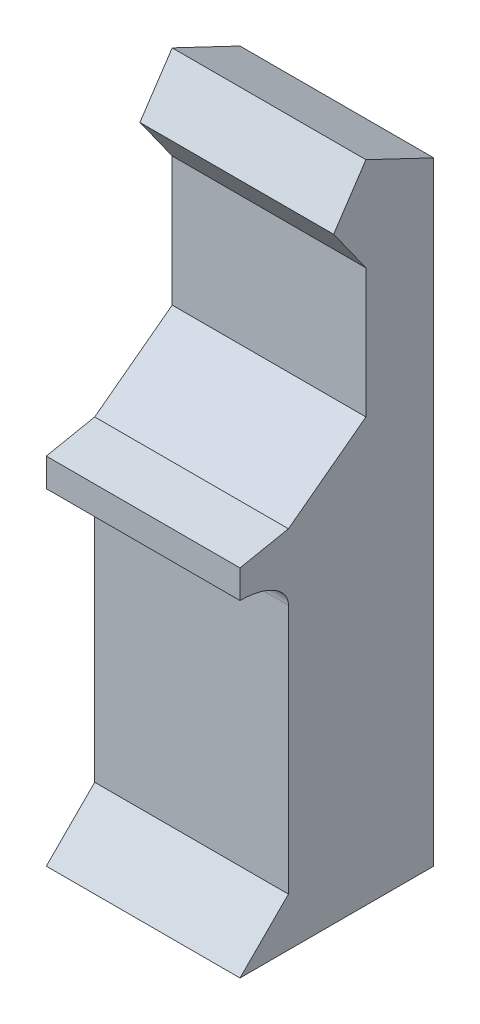
from build123d import *

# Parameters (mm, degrees)
ESQUISSE1_W                   = 600
ESQUISSE1_H                   = 600
BOSS_EXTRU_1_DEPTH            = 2000
ESQUISSE11_W                  = 150
ESQUISSE11_H                  = 800
ENL_V_MAT_EXTRU_1_DEPTH       = 600
ESQUISSE12_W                  = 150
ESQUISSE12_H                  = 1100
ENL_V_MAT_EXTRU_2_DEPTH       = 600
ESQUISSE14_W                  = 150
ESQUISSE14_H                  = 150
BOSS_EXTRU_3_DEPTH            = 600
ENL_V_MAT_EXTRU_5_DEPTH       = 600
ESQUISSE19_W                  = 150
ESQUISSE19_H                  = 100
ENL_V_MAT_EXTRU_6_DEPTH       = 600
ESQUISSE25_W                  = 150
ESQUISSE25_H                  = 100
BOSS_EXTRU_4_DEPTH            = 600
ESQUISSE26_W                  = 150
ESQUISSE26_H                  = 75
BOSS_EXTRU_7_DEPTH            = 600
ESQUISSE30_RX                 = 150
ESQUISSE30_RY                 = 87.5
ENL_V_MAT_EXTRU_7_DEPTH       = 600
ESQUISSE32_W                  = 150
ESQUISSE32_H                  = 30
BOSS_EXTRU_8_DEPTH            = 600
ENL_V_MAT_EXTRU_8_DEPTH       = 2158.978826807
ENL_V_MAT_EXTRU_8_DEPTH_BACK  = 600
ESQUISSE34_W                  = 240
ESQUISSE34_H                  = 870
ENL_V_MAT_EXTRU_9_DEPTH       = 600
ESQUISSE35_W                  = 240
ESQUISSE35_H                  = 180
BOSS_EXTRU_9_DEPTH            = 600
ENL_V_START                   = -600
ENL_V_MAT_EXTRU_10_DEPTH      = 600
ENL_V_MAT_EXTRU_11_DEPTH      = 2158.978826807
ENL_V_MAT_EXTRU_11_DEPTH_BACK = 600
ENL_V_MAT_EXTRU_12_DEPTH      = 2158.978826807
ENL_V_MAT_EXTRU_12_DEPTH_BACK = 600
ESQUISSE41_W                  = 210
ESQUISSE41_H                  = 100
BOSS_EXTRU_10_DEPTH           = 600
ESQUISSE43_W                  = 100
ESQUISSE43_H                  = 150
BOSS_EXTRU_12_DEPTH           = 600
ESQUISSE44_W                  = 100
ESQUISSE44_H                  = 140
BOSS_EXTRU_13_DEPTH           = 600
ENL_V_MAT_EXTRU_13_DEPTH      = 600
ENL_V_MAT_EXTRU_14_DEPTH      = 600
ENL_V_MAT_EXTRU_15_DEPTH      = 600


# Read off the part's stored shape, not the designer's step: Enlèv. mat.-Extru.10
with BuildPart() as part:
    # Esquisse1 → Boss.-Extru.1 (new body)
    with BuildSketch(Plane(origin=(0, 0, 0), x_dir=(1, 0, 0), z_dir=(0, 1, 0))):
        with Locations((224.80933771, 244.860180987)):
            Rectangle(ESQUISSE1_W, ESQUISSE1_H)
    extrude(amount=BOSS_EXTRU_1_DEPTH)

    # Esquisse11 → Enlèv. mat.-Extru.1 (cut)
    with BuildSketch(Plane(origin=(524.80933771, 0, 0), x_dir=(0, 0, -1), z_dir=(1, 0, 0))):
        with Locations((19.860180987, 400)):
            Rectangle(ESQUISSE11_W, ESQUISSE11_H)
    extrude(amount=-ENL_V_MAT_EXTRU_1_DEPTH, mode=Mode.SUBTRACT)

    # Esquisse12 → Enlèv. mat.-Extru.2 (cut)
    with BuildSketch(Plane(origin=(524.80933771, 0, 0), x_dir=(0, 0, -1), z_dir=(1, 0, 0))):
        with Locations((19.860180987, 1450)):
            Rectangle(ESQUISSE12_W, ESQUISSE12_H)
    extrude(amount=-ENL_V_MAT_EXTRU_2_DEPTH, mode=Mode.SUBTRACT)

    # Esquisse14 → Boss.-Extru.3 (add)
    with BuildSketch(Plane(origin=(524.80933771, 0, 0), x_dir=(0, 0, -1), z_dir=(1, 0, 0))):
        with Locations((19.860180987, 75)):
            Rectangle(ESQUISSE14_W, ESQUISSE14_H)
    extrude(amount=-BOSS_EXTRU_3_DEPTH)

    # Esquisse18 → Enlèv. mat.-Extru.5 (cut)
    with BuildSketch(Plane(origin=(524.80933771, 0, 0), x_dir=(0, 0, -1), z_dir=(1, 0, 0))):
        Polygon((94.860180987, 150), (-55.139819013, 0), (-55.139819013, 150), align=None)
    extrude(amount=-ENL_V_MAT_EXTRU_5_DEPTH, mode=Mode.SUBTRACT)

    # Esquisse19 → Enlèv. mat.-Extru.6 (cut)
    with BuildSketch(Plane(origin=(524.80933771, 0, 0), x_dir=(0, 0, -1), z_dir=(1, 0, 0))):
        with Locations((19.860180987, 850)):
            Rectangle(ESQUISSE19_W, ESQUISSE19_H)
    extrude(amount=-ENL_V_MAT_EXTRU_6_DEPTH, mode=Mode.SUBTRACT)

    # Esquisse25 → Boss.-Extru.4 (add)
    with BuildSketch(Plane(origin=(524.80933771, 0, 0), x_dir=(0, 0, -1), z_dir=(1, 0, 0))):
        with Locations((19.860180987, 1050)):
            Rectangle(ESQUISSE25_W, ESQUISSE25_H)
    extrude(amount=-BOSS_EXTRU_4_DEPTH)

    # Esquisse26 → Boss.-Extru.7 (add)
    with BuildSketch(Plane(origin=(524.80933771, 0, 0), x_dir=(0, 0, -1), z_dir=(1, 0, 0))):
        with Locations((19.860180987, 962.5)):
            Rectangle(ESQUISSE26_W, ESQUISSE26_H)
    extrude(amount=-BOSS_EXTRU_7_DEPTH)

    # Esquisse30 → Enlèv. mat.-Extru.7 (cut)
    with BuildSketch(Plane(origin=(524.80933771, 0, 0), x_dir=(0, 0, -1), z_dir=(1, 0, 0))):
        with Locations((-55.139819013, 925)):
            Ellipse(ESQUISSE30_RX, ESQUISSE30_RY)
    extrude(amount=-ENL_V_MAT_EXTRU_7_DEPTH, mode=Mode.SUBTRACT)

    # Esquisse32 → Boss.-Extru.8 (add)
    with BuildSketch(Plane(origin=(524.80933771, 0, 0), x_dir=(0, 0, -1), z_dir=(1, 0, 0))):
        with Locations((19.860180987, 1115)):
            Rectangle(ESQUISSE32_W, ESQUISSE32_H)
    extrude(amount=-BOSS_EXTRU_8_DEPTH)

    # Esquisse33 → Enlèv. mat.-Extru.8 (cut, two sides: drawn at the far end of the back side and taken through both)
    with BuildSketch(Plane(origin=(524.80933771, 0, 0), x_dir=(0, 0, -1), z_dir=(1, 0, 0)).offset(-ENL_V_MAT_EXTRU_8_DEPTH_BACK)):
        Polygon((94.860180987, 1130), (-55.139819013, 1130), (-55.139819013, 1100), align=None)
    extrude(amount=ENL_V_MAT_EXTRU_8_DEPTH + ENL_V_MAT_EXTRU_8_DEPTH_BACK, mode=Mode.SUBTRACT)

    # Esquisse34 → Enlèv. mat.-Extru.9 (cut)
    with BuildSketch(Plane(origin=(524.80933771, 0, 0), x_dir=(0, 0, -1), z_dir=(1, 0, 0))):
        with Locations((214.860180987, 1565)):
            Rectangle(ESQUISSE34_W, ESQUISSE34_H)
    extrude(amount=-ENL_V_MAT_EXTRU_9_DEPTH, mode=Mode.SUBTRACT)

    # Esquisse35 → Boss.-Extru.9 (add)
    with BuildSketch(Plane(origin=(524.80933771, 0, 0), x_dir=(0, 0, -1), z_dir=(1, 0, 0))):
        with Locations((214.860180987, 1220)):
            Rectangle(ESQUISSE35_W, ESQUISSE35_H)
    extrude(amount=-BOSS_EXTRU_9_DEPTH)

    # Enlèv. mat.-Extru.10 outline → Enlèv. mat.-Extru.10 (cut)
    with BuildSketch(Plane(origin=(524.80933771, 0, 0), x_dir=(0, 0, -1), z_dir=(1, 0, 0)).offset(ENL_V_START)):
        Polygon((94.860180987, 1310), (94.860180987, 1130), (334.860180987, 1310), align=None)
    extrude(amount=ENL_V_MAT_EXTRU_10_DEPTH, mode=Mode.SUBTRACT)

    # Esquisse37 → Enlèv. mat.-Extru.11 (cut, two sides: drawn at the far end of the back side and taken through both)
    with BuildSketch(Plane(origin=(524.80933771, 0, 0), x_dir=(0, 0, -1), z_dir=(1, 0, 0)).offset(-ENL_V_MAT_EXTRU_11_DEPTH_BACK)):
        Polygon((544.860180987, 1900), (544.860180987, 2000), (394.860180987, 2000), align=None)
    extrude(amount=ENL_V_MAT_EXTRU_11_DEPTH + ENL_V_MAT_EXTRU_11_DEPTH_BACK, mode=Mode.SUBTRACT)

    # Esquisse38 → Enlèv. mat.-Extru.12 (cut, two sides: drawn at the far end of the back side and taken through both)
    with BuildSketch(Plane(origin=(524.80933771, 0, 0), x_dir=(0, 0, -1), z_dir=(1, 0, 0)).offset(-ENL_V_MAT_EXTRU_12_DEPTH_BACK)):
        Polygon((2509.437735817, 5524.295924716), (394.860180987, 2000), (334.860180987, 1900), (-1779.717373842, -1624.295924716), (-8828.309223275, 2604.859184943), (-4539.154113615, 9753.451034376), align=None)
    extrude(amount=ENL_V_MAT_EXTRU_12_DEPTH + ENL_V_MAT_EXTRU_12_DEPTH_BACK, mode=Mode.SUBTRACT)

    # Esquisse41 → Boss.-Extru.10 (add)
    with BuildSketch(Plane(origin=(524.80933771, 0, 0), x_dir=(0, 0, -1), z_dir=(1, 0, 0))):
        with Locations((439.860180987, 1950)):
            Rectangle(ESQUISSE41_W, ESQUISSE41_H)
    extrude(amount=-BOSS_EXTRU_10_DEPTH)

    # Esquisse43 → Boss.-Extru.12 (add)
    with BuildSketch(Plane(origin=(524.80933771, 0, 0), x_dir=(0, 0, -1), z_dir=(1, 0, 0))):
        with Locations((284.860180987, 1925)):
            Rectangle(ESQUISSE43_W, ESQUISSE43_H)
    extrude(amount=-BOSS_EXTRU_12_DEPTH)

    # Esquisse44 → Boss.-Extru.13 (add)
    with BuildSketch(Plane(origin=(524.80933771, 0, 0), x_dir=(0, 0, -1), z_dir=(1, 0, 0))):
        with Locations((284.860180987, 1780)):
            Rectangle(ESQUISSE44_W, ESQUISSE44_H)
    extrude(amount=-BOSS_EXTRU_13_DEPTH)

    # Esquisse45 → Enlèv. mat.-Extru.13 (cut)
    with BuildSketch(Plane(origin=(524.80933771, 0, 0), x_dir=(0, 0, -1), z_dir=(1, 0, 0))):
        Polygon((334.860180987, 1710), (234.860180987, 1850), (234.860180987, 1710), align=None)
    extrude(amount=-ENL_V_MAT_EXTRU_13_DEPTH, mode=Mode.SUBTRACT)

    # Esquisse46 → Enlèv. mat.-Extru.14 (cut)
    with BuildSketch(Plane(origin=(524.80933771, 0, 0), x_dir=(0, 0, -1), z_dir=(1, 0, 0))):
        Polygon((234.860180987, 1850), (334.860180987, 2000), (234.860180987, 2000), align=None)
    extrude(amount=-ENL_V_MAT_EXTRU_14_DEPTH, mode=Mode.SUBTRACT)

    # Esquisse47 → Enlèv. mat.-Extru.15 (cut)
    with BuildSketch(Plane(origin=(524.80933771, 0, 0), x_dir=(0, 0, -1), z_dir=(1, 0, 0))):
        Polygon((544.860180987, 2000), (334.860180987, 2000), (544.860180987, 1900), align=None)
    extrude(amount=-ENL_V_MAT_EXTRU_15_DEPTH, mode=Mode.SUBTRACT)


solid = part.part
